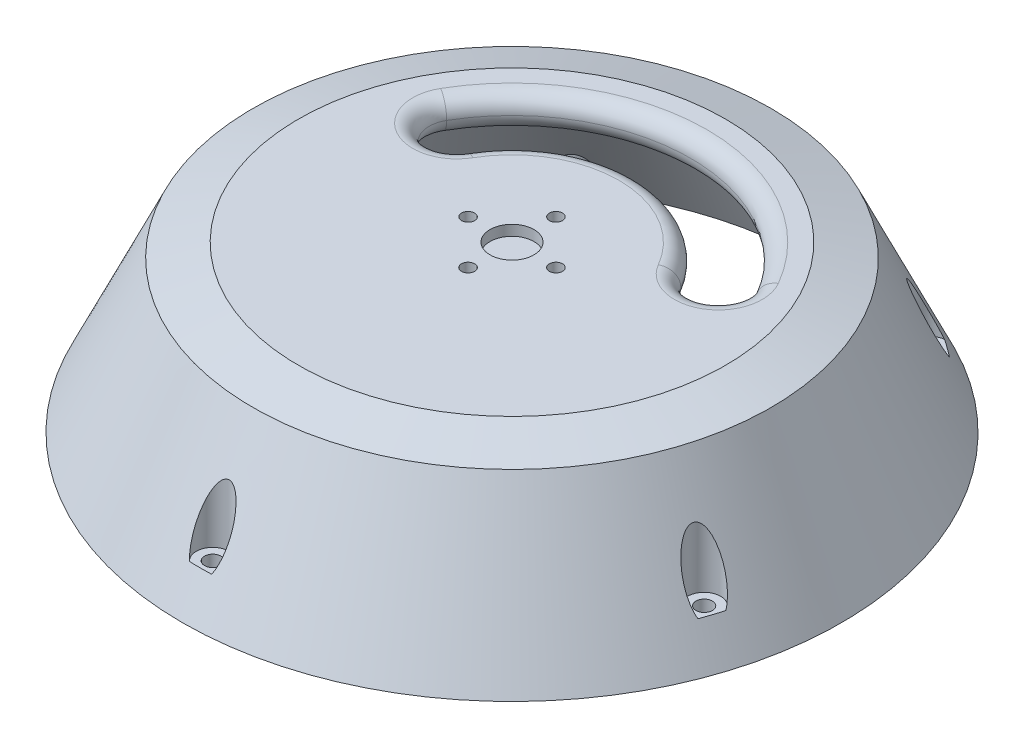
from build123d import *

# Parameters (mm, degrees)
SKETCH1_W           = 46.010770255
SKETCH1_H           = 6
SKETCH2_R           = 1.2
CUT_EXTRUDE1_DEPTH  = 10
SKETCH3_R           = 4
CUT_EXTRUDE2_DEPTH  = 1.9
SKETCH4_R           = 3
CUT_EXTRUDE3_DEPTH  = 88.914731416
BOSS_EXTRUDE1_REACH = 92
SKETCH5_R           = 4
SKETCH6_R           = 1.5
CUT_EXTRUDE4_DEPTH  = 88.914731579
CIRPATTERN1_COUNT   = 5
CHAMFER3_SIZE       = 2.74
CHAMFER3_SIZE2      = 7.15
FILLET1_R           = 3
FILLET2_R           = 2


with BuildPart() as part:
    # Sketch1 → Revolve1 (revolve)
    with BuildSketch(Plane(origin=(0, 0, 0), x_dir=(0, 0, -1), z_dir=(1, 0, 0)), mode=Mode.PRIVATE) as revolve1_sk:
        with Locations((23.005385128, -3)):
            Rectangle(SKETCH1_W, SKETCH1_H)
        Polygon((60, -30), (46.010770255, 0), (46.010770255, -6), (43.291726609, -6), (54.483110405, -30), align=None)
    revolve(revolve1_sk.sketch.rotate(Axis((0, 0, 0), (0, -1, 0)), 180), axis=Axis((0, 0, 0), (0, -1, 0)))

    # Sketch2 → Cut-Extrude1 (cut)
    with BuildSketch(Plane(origin=(0, 0, 0), x_dir=(1, 0, 0), z_dir=(0, 1, 0))):
        with Locations(Location((0, 8, 0), (0, 0, 270))):
            Circle(SKETCH2_R)
        with Locations(Location((8, 0, 0), (0, 0, 270))):
            Circle(SKETCH2_R)
        with Locations(Location((0, -8, 0), (0, 0, 270))):
            Circle(SKETCH2_R)
        with Locations(Location((-8, 0, 0), (0, 0, 270))):
            Circle(SKETCH2_R)
        with BuildLine():
            ThreePointArc((-19.485571518, 11.250000117), (2.8e-08, 22.5), (19.485571545, 11.250000069))
            ThreePointArc((19.485571545, 11.250000069), (26.315698577, 9.419872966), (28.145825614, 16.250000016))
            ThreePointArc((28.145825614, 16.250000016), (0, 32.5), (-28.145825614, 16.250000016))
            ThreePointArc((-28.145825614, 16.250000016), (-26.315698553, 9.419872952), (-19.485571518, 11.250000117))
        make_face()
    extrude(amount=-CUT_EXTRUDE1_DEPTH, mode=Mode.SUBTRACT)

    # Sketch3 → Cut-Extrude2 (cut)
    with BuildSketch(Plane(origin=(0, 0, 0), x_dir=(1, 0, 0), z_dir=(0, 1, 0))):
        with Locations(Location((0, 0, 0), (0, 0, 270))):
            Circle(SKETCH3_R)
    extrude(amount=-CUT_EXTRUDE2_DEPTH, mode=Mode.SUBTRACT)

    # Sketch4 → Cut-Extrude3 (cut, through all)
    with BuildSketch(Plane(origin=(0, -23, 0), x_dir=(-1, 0, 0), z_dir=(0, -1, 0))):
        with Locations((0, -54.483110405)):
            Circle(SKETCH4_R)
    cut_extrude3 = extrude(amount=-CUT_EXTRUDE3_DEPTH, mode=Mode.SUBTRACT)

    # Sketch5 → Boss-Extrude1 (add, up to next)
    with BuildSketch(Plane.XZ.offset(30), mode=Mode.PRIVATE) as boss_extrude1_sk1:
        with Locations((0, 54.483110405)):
            Circle(SKETCH5_R)
    boss_extrude1_tool1 = extrude(boss_extrude1_sk1.sketch, amount=-BOSS_EXTRUDE1_REACH, mode=Mode.PRIVATE) - part.part
    boss_extrude1 = boss_extrude1_tool1.solids().sort_by_distance((0, -30, 54.48311))[0]
    add(boss_extrude1)

    # Sketch6 → Cut-Extrude4 (cut, through all)
    with BuildSketch(Plane(origin=(0, -23, 0), x_dir=(1, 0, 0), z_dir=(0, 1, 0))):
        with Locations(Location((0, -54.483110405, 0), (0, 0, 270))):
            Circle(SKETCH6_R)
    cut_extrude4 = extrude(amount=-CUT_EXTRUDE4_DEPTH, mode=Mode.SUBTRACT)

    # CirPattern1: Cut-Extrude3, Boss-Extrude1, Cut-Extrude4 ×5 about axis
    cirpattern1_axis = Axis((0, 0, 0), (0, 1, 0))
    add([cut_extrude3.rotate(cirpattern1_axis, i * 360 / CIRPATTERN1_COUNT) for i in range(1, CIRPATTERN1_COUNT)], mode=Mode.SUBTRACT)
    add([boss_extrude1.rotate(cirpattern1_axis, i * 360 / CIRPATTERN1_COUNT) for i in range(1, CIRPATTERN1_COUNT)])
    add([cut_extrude4.rotate(cirpattern1_axis, i * 360 / CIRPATTERN1_COUNT) for i in range(1, CIRPATTERN1_COUNT)], mode=Mode.SUBTRACT)

    # Chamfer3
    chamfer3_edges = [part.edges().sort_by_distance(p)[0] for p in [
        (0, 0, -46.010770255),
    ]]
    chamfer3_side = [part.faces().sort_by_distance(p)[0] for p in [
        (0, -15, -53.005385128),
    ]]
    chamfer(chamfer3_edges, length=CHAMFER3_SIZE, length2=CHAMFER3_SIZE2, reference=chamfer3_side[0])

    # Fillet1
    fillet1_edges = [part.edges().sort_by_distance(p)[0] for p in [
        (-26.315698553, 0, -9.419872952),
        (-26.315698553, -6, -9.419872952),
        (0, -6, -32.5),
        (0, 0, -32.5),
        (26.315698577, -6, -9.419872966),
        (26.315698577, 0, -9.419872966),
        (2.8e-08, 0, -22.5),
        (2.8e-08, -6, -22.5),
    ]]
    fillet(fillet1_edges, radius=FILLET1_R - 0.0001)  # a hair under: the kernel refuses the full size

    # Fillet2
    fillet2_edges = [part.edges().sort_by_distance(p)[0] for p in [
        (0, -6, -43.291726609),
    ]]
    fillet(fillet2_edges, radius=FILLET2_R)


solid = part.part
